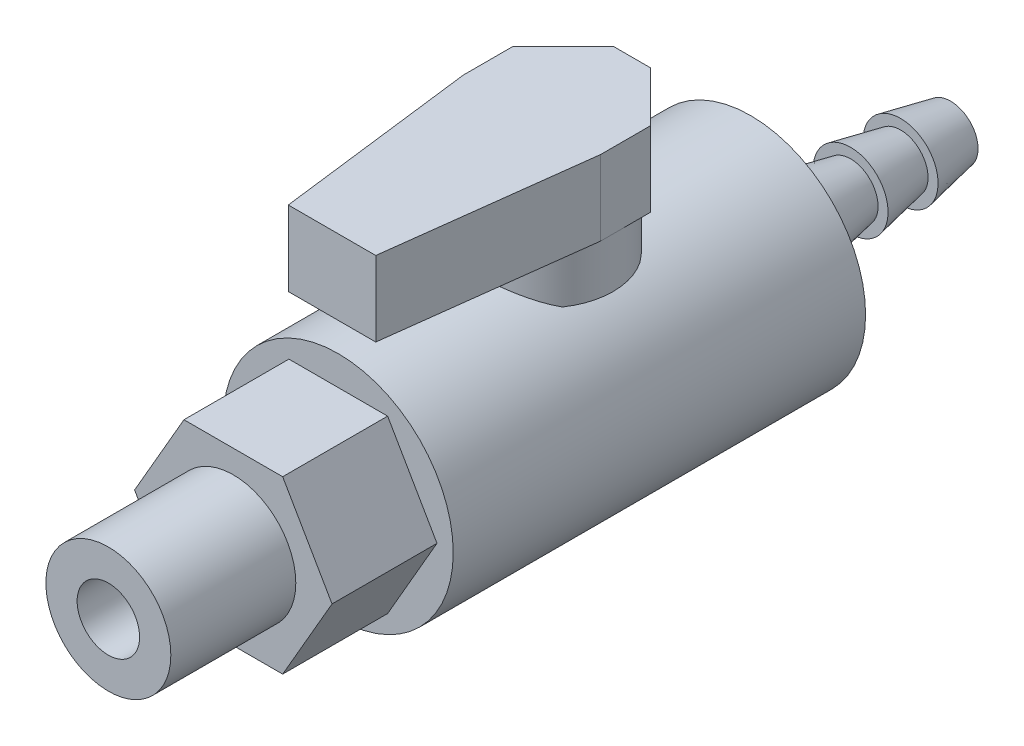
from build123d import *
from OCP.BRepFilletAPI import BRepFilletAPI_MakeChamfer

# Parameters (mm, degrees)
SKETCH3_R           = 10.16
CUT_EXTRUDE1_DEPTH  = 10.668
SKETCH4_R           = 6.985
BOSS_EXTRUDE1_DEPTH = 5.08
SKETCH5_W           = 13.97
SKETCH5_H           = 30.48
BOSS_EXTRUDE2_DEPTH = 7.62
CHAMFER1_SIZE       = 5.08
CHAMFER2_SIZE       = 20.32
CHAMFER2_SIZE2      = 2.54


# Read off the part's stored shape, not the designer's step: LPattern8
with BuildPart() as part:
    # Sketch1 → Revolve1 (revolve)
    with BuildSketch(Plane(origin=(0, 0, 0), x_dir=(1, 0, 0), z_dir=(0, 1, 0))):
        Polygon((3.81, 85.598), (3.81, 65.278), (11.684, 65.278), (11.684, 23.368), (10.16, 23.368), (10.16, 12.7), (6.35, 12.7), (6.35, 0), (3.175, 0), (3.175, 65.278), (1.905, 85.598), align=None)
    revolve(axis=Axis((0, 0, 0), (0, 0, -1)))

    # Sketch2 → Cut-Revolve1 (revolve, cut)
    with BuildSketch(Plane(origin=(0, 0, 0), x_dir=(1, 0, 0), z_dir=(0, 1, 0))):
        Polygon((3.81, 85.598), (2.794, 85.598), (3.81, 80.518), align=None)
    revolve(axis=Axis((0, 0, 0), (0, 0, 1)), mode=Mode.SUBTRACT)

    # LPattern8 outline → LPattern8 (revolve, cut)
    with BuildSketch(Plane.XZ):
        Polygon((3.81, -75.438), (2.794, -80.518), (3.81, -80.518), align=None)
        Polygon((2.794, -75.438), (3.81, -75.438), (3.81, -70.358), align=None)
    revolve(axis=Axis((0, 0, 0), (0, 0, 1)), mode=Mode.SUBTRACT)

    # Sketch3 → Cut-Extrude1 (cut)
    with BuildSketch(Plane.XY.offset(-12.7)):
        Circle(SKETCH3_R)
        Polygon((5.0165, -8.688832876), (10.033, 0), (5.0165, 8.688832876), (-5.0165, 8.688832876), (-10.033, 0), (-5.0165, -8.688832876), align=None, mode=Mode.SUBTRACT)
    extrude(amount=-CUT_EXTRUDE1_DEPTH, mode=Mode.SUBTRACT)

    # Sketch4 → Boss-Extrude1 (add)
    with BuildSketch(Plane(origin=(0, 10.16, 0), x_dir=(1, 0, 0), z_dir=(0, 1, 0))):
        with Locations(Location((0, 44.323, 0), (0, 0, 34.307651456))):
            Circle(SKETCH4_R)
    extrude(amount=BOSS_EXTRUDE1_DEPTH)

    # Sketch5 → Boss-Extrude2 (add)
    with BuildSketch(Plane(origin=(0, 15.24, 0), x_dir=(1, 0, 0), z_dir=(0, 1, 0))):
        with Locations((0, 37.973)):
            Rectangle(SKETCH5_W, SKETCH5_H)
    extrude(amount=BOSS_EXTRUDE2_DEPTH)

    # Chamfer1
    chamfer1_edges = [part.edges().sort_by_distance(p)[0] for p in [
        (-6.985, 19.05, -53.213),
        (6.985, 19.05, -53.213),
    ]]
    chamfer(chamfer1_edges, length=CHAMFER1_SIZE)

    # Chamfer2: one chamfer whose edges measure the first distance from different faces: ONE call of the kernel's chamfer builder (chamfer() names one face for all edges)
    chamfer2_edges_1 = [part.edges().sort_by_distance(p)[0] for p in [
        (-6.985, 19.05, -22.733),
    ]]
    chamfer2_side_1 = [part.faces().sort_by_distance(p)[0] for p in [
        (-6.985, 19.05, -35.433),
    ]]
    chamfer2_edges_2 = [part.edges().sort_by_distance(p)[0] for p in [
        (6.985, 19.05, -22.733),
    ]]
    chamfer2_side_2 = [part.faces().sort_by_distance(p)[0] for p in [
        (6.985, 19.05, -35.433),
    ]]
    chamfer2 = BRepFilletAPI_MakeChamfer(part.part.solid().wrapped)
    for e in chamfer2_edges_1:
        chamfer2.Add(CHAMFER2_SIZE, CHAMFER2_SIZE2, e.wrapped, chamfer2_side_1[0].wrapped)  # the first distance lies on this face
    for e in chamfer2_edges_2:
        chamfer2.Add(CHAMFER2_SIZE, CHAMFER2_SIZE2, e.wrapped, chamfer2_side_2[0].wrapped)  # the first distance lies on this face
    add(Compound.cast(chamfer2.Shape()), mode=Mode.REPLACE)


solid = part.part
